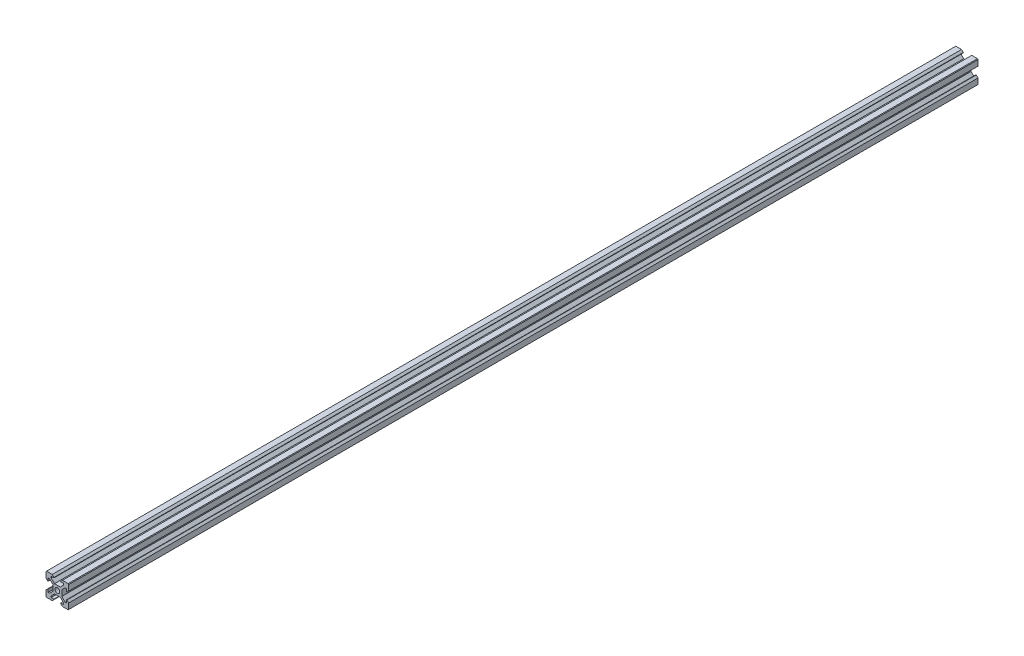
from build123d import *

# Parameters (mm, degrees)
BOSS_EXTRUDE1_DEPTH = 800
CHAMFER2_SIZE       = 0.5
CHAMFER2_SIZE2      = 0.353553391
CHAMFER1_SIZE       = 0.5


with BuildPart() as part:
    # Sketch1 → Boss-Extrude1 (new body)
    with BuildSketch(Plane.XY):
        with BuildLine():
            Line((5.5, 6.829360749), (2.570639251, 3.9))
            Line((2.570639251, 3.9), (0, 3.9))
            Line((0, 3.9), (0, 2.1))
            ThreePointArc((0, 2.1), (0.803635208, 1.940147018), (1.48492424, 1.48492424))
            Line((1.48492424, 1.48492424), (10, 10))
            Line((10, 10), (4.5, 10))
            Line((4.5, 10), (2.62, 8.12))
            Line((2.62, 8.12), (5.5, 8.12))
            Line((5.5, 8.12), (5.5, 6.829360749))
        make_face()
    extrude(amount=BOSS_EXTRUDE1_DEPTH)

    # Chamfer2
    chamfer2_edges = [part.edges().sort_by_distance(p)[0] for p in [
        (2.62, 8.12, 400),
    ]]
    chamfer2_side = [part.faces().sort_by_distance(p)[0] for p in [
        (3.56, 9.06, 400),
    ]]
    chamfer(chamfer2_edges, length=CHAMFER2_SIZE, length2=CHAMFER2_SIZE2, reference=chamfer2_side[0])

    # Mirror1: part across plane


with BuildPart() as part_1:
    add(part.part)
    add(part.part.mirror(Plane(origin=(10, 10, 800), x_dir=(0, 0, 1), z_dir=(-0.707106781186544, 0.7071067811865511, 0))))

    # Chamfer1
    chamfer1_edges = [part_1.edges().sort_by_distance(p)[0] for p in [
        (10, 10, 400),
    ]]
    chamfer(chamfer1_edges, length=CHAMFER1_SIZE)

    # Mirror4: part across plane


with BuildPart() as part_2:
    add(part_1.part)
    add(part_1.part.mirror(Plane(origin=(0, 3.9, 800), x_dir=(0, 0, 1), z_dir=(1, 0, 0))))

    # Mirror5: part across plane


with BuildPart() as part_3:
    add(part_2.part)
    add(part_2.part.mirror(Plane(origin=(-3.9, 0, 800), x_dir=(0, 0, 1), z_dir=(0, 1, 0))))


solid = part_3.part
